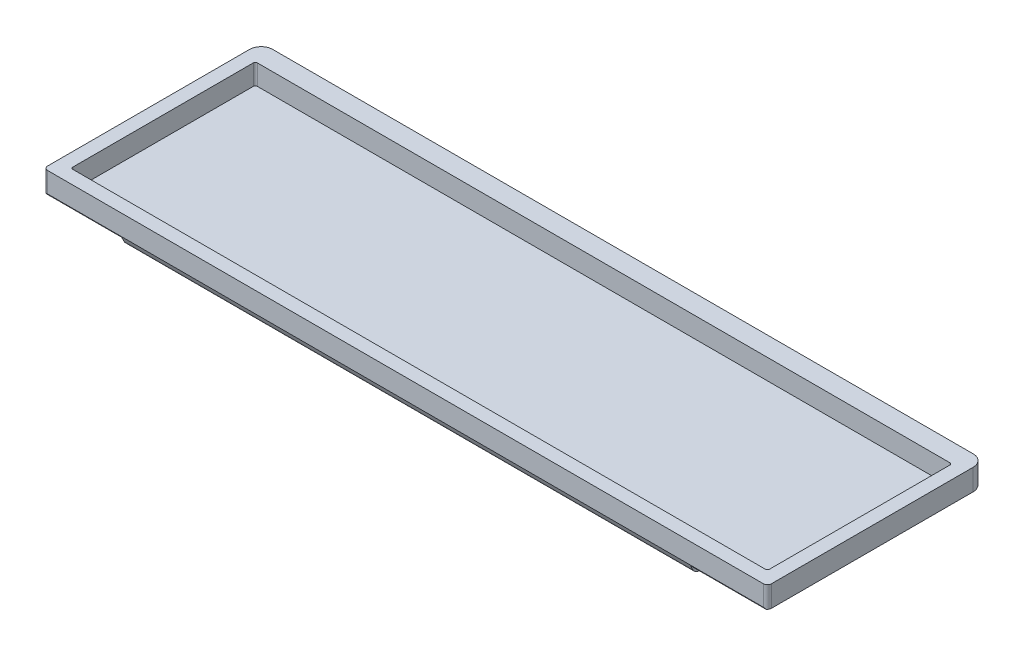
from build123d import *

# Parameters (mm, degrees)
BOSS_EXTRUDE1_DEPTH = 10.5
BOSS_EXTRUDE3_START = 10.5
BOSS_EXTRUDE3_DEPTH = 10.5
CUT_EXTRUDE1_DEPTH  = 400
FILLET2_R           = 3
SKETCH7_W           = 45.407703875
SKETCH7_H           = 112.25
SKETCH7_W_2         = 53.767438665
CUT_EXTRUDE2_DEPTH  = 10


with BuildPart() as part:
    # Sketch2 → Boss-Extrude1 (new body)
    with BuildSketch(Plane(origin=(0, 0, 0), x_dir=(1, 0, 0), z_dir=(0, 1, 0))):
        with BuildLine():
            Line((180.825, 57.625), (-180.825, 57.625))
            ThreePointArc((-180.825, 57.625), (-185.067640687, 55.867640687), (-186.825, 51.625))
            Line((-186.825, 51.625), (-186.825, -52.625))
            ThreePointArc((-186.825, -52.625), (-186.239213562, -54.039213562), (-184.825, -54.625))
            Line((-184.825, -54.625), (184.825, -54.625))
            ThreePointArc((184.825, -54.625), (186.239213562, -54.039213562), (186.825, -52.625))
            Line((186.825, -52.625), (186.825, 51.625))
            ThreePointArc((186.825, 51.625), (185.067640687, 55.867640687), (180.825, 57.625))
        make_face()
        with BuildLine():
            Line((-179.825, -46.625), (-179.825, 46.625))
            ThreePointArc((-179.825, 46.625), (-179.532106781, 47.332106781), (-178.825, 47.625))
            Line((-178.825, 47.625), (178.825, 47.625))
            ThreePointArc((178.825, 47.625), (179.532106781, 47.332106781), (179.825, 46.625))
            Line((179.825, 46.625), (179.825, -46.625))
            ThreePointArc((179.825, -46.625), (179.532106781, -47.332106781), (178.825, -47.625))
            Line((178.825, -47.625), (-178.825, -47.625))
            ThreePointArc((-178.825, -47.625), (-179.532106781, -47.332106781), (-179.825, -46.625))
        make_face(mode=Mode.SUBTRACT)
    extrude(amount=BOSS_EXTRUDE1_DEPTH)

    # Sketch4 → Boss-Extrude3 (add)
    with BuildSketch(Plane.XZ.offset(BOSS_EXTRUDE3_START)):
        with BuildLine():
            ThreePointArc((180.825, -57.625), (185.067640687, -55.867640687), (186.825, -51.625))
            Line((186.825, -51.625), (186.825, 52.625))
            ThreePointArc((186.825, 52.625), (186.239213562, 54.039213562), (184.825, 54.625))
            Line((184.825, 54.625), (-184.825, 54.625))
            ThreePointArc((-184.825, 54.625), (-186.239213562, 54.039213562), (-186.825, 52.625))
            Line((-186.825, 52.625), (-186.825, -51.625))
            ThreePointArc((-186.825, -51.625), (-185.067640687, -55.867640687), (-180.825, -57.625))
            Line((-180.825, -57.625), (180.825, -57.625))
        make_face()
    extrude(amount=-BOSS_EXTRUDE3_DEPTH)

    # Sketch5 → Cut-Extrude1 (cut)
    with BuildSketch(Plane(origin=(186.825, 0, 0), x_dir=(0, 0, -1), z_dir=(1, 0, 0))):
        Polygon((-52.625, -4), (-54.625, 0), (-54.625, -10.5), (-38.004808483, -10.5), align=None)
        Polygon((-38.004808483, -10.5), (57.625, -10.5), (57.625, 0), align=None)
    extrude(amount=-CUT_EXTRUDE1_DEPTH, mode=Mode.SUBTRACT)

    # Fillet2
    fillet2_edges = [part.edges().sort_by_distance(p)[0] for p in [
        (0, -10.5, 38.004808483),
        (0, -4, 52.625),
    ]]
    fillet(fillet2_edges, radius=FILLET2_R)

    # Sketch7 → Cut-Extrude2 (cut)
    with BuildSketch(Plane(origin=(0, -10.5, 0), x_dir=(1, 0, 0), z_dir=(0, 1, 0))):
        with Locations((169.528851938, 1.5)):
            Rectangle(SKETCH7_W, SKETCH7_H)
        with Locations((-173.708719333, 1.5)):
            Rectangle(SKETCH7_W_2, SKETCH7_H)
    extrude(amount=CUT_EXTRUDE2_DEPTH, mode=Mode.SUBTRACT)


solid = part.part
